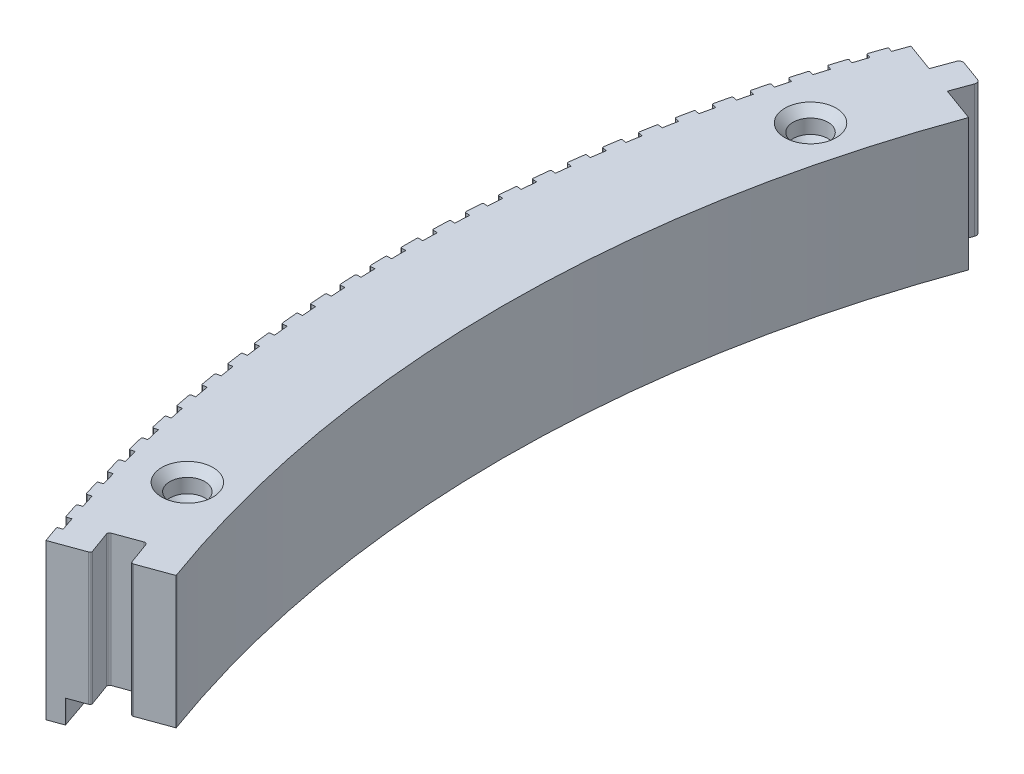
from build123d import *

# Parameters (mm, degrees)
CUT_EXTRUDE4_DEPTH                         = 448.112802595
TONGUE_DEPTH                               = 33.02
GROOVE_REACH                               = 337.991
NOTCH_DEPTH                                = 336.991121427
FILLET_NOTCH_R                             = 0.254
CIRPATTERN_NOTCHES_START                   = -38.862
CIRPATTERN_NOTCHES_DEPTH                   = 38.862
CUT_EXTRUDE7_DEPTH                         = 38.862
SKETCH4_R                                  = 2.1971
HOLES_MOUNTINGBOTTOM_DEPTH                 = 336.365614775
SKETCH11_R                                 = 4.3815
RELIEFHOLESFORSOCKETCAPSCREWS_DEPTH        = 7.62
CHAMFER_RELIEFHOLESFORSOCKETCAPSCREWS_SIZE = 2.032
SKETCH12_W                                 = 8.8519
SKETCH12_H                                 = 33.02
EXTENDLENGTH_DEPTH                         = 0.3048
FILLET_GROOVE_R                            = 0.508
RELIEF_VERSIONNUMBER_DEPTH                 = 0.6


# Read off the part's stored shape, not the designer's step: CirPattern-Notches
with BuildPart() as part:
    # Sketch1 → Revolve1 (revolve)
    with BuildSketch(Plane.XY, mode=Mode.PRIVATE) as revolve1_sk:
        Polygon((-289.56, 0), (-314.96, 0), (-314.96, -38.862), (-311.15, -38.862), (-311.15, -33.02), (-289.56, -33.02), align=None)
    revolve(revolve1_sk.sketch.rotate(Axis((0, 4.1402, 0), (0, -1, 0)), 270), axis=Axis((0, 4.1402, 0), (0, -1, 0)))

    # Sketch3 → Cut-Extrude4 (cut, through all)
    with BuildSketch(Plane(origin=(0, 0, 0), x_dir=(1, 0, 0), z_dir=(0, 1, 0))):
        with BuildLine():
            Line((-340.36, 123.880908935), (0, 0))
            Line((0, 0), (-170.18, -61.940454467))
            Line((-170.18, -61.940454467), (-170.180868731, -61.938067648))
            Line((-170.180868731, -61.938067648), (-340.36, -123.878205923))
            Line((-340.36, -123.878205923), (-340.36, -123.880908935))
            ThreePointArc((-340.36, -123.880908935), (362.20354664, 0), (-340.36, 123.880908935))
        make_face()
    extrude(amount=-CUT_EXTRUDE4_DEPTH, mode=Mode.SUBTRACT)

    # Sketch5 → Tongue (add)
    with BuildSketch(Plane(origin=(0, 0, 0), x_dir=(1, 0, 0), z_dir=(0, 1, 0))):
        with BuildLine():
            Line((-280.451262674, 102.075911776), (-278.626927229, 107.088232215))
            ThreePointArc((-278.626927229, 107.088232215), (-278.66084622, 107.865104834), (-279.234162466, 108.390452383))
            Line((-279.234162466, 108.390452383), (-284.485164831, 110.301660944))
            ThreePointArc((-284.485164831, 110.301660944), (-285.262037451, 110.267741953), (-285.787384999, 109.694425707))
            Line((-285.787384999, 109.694425707), (-287.611720444, 104.682105268))
            Line((-287.611720444, 104.682105268), (-280.451262674, 102.075911776))
        make_face()
    extrude(amount=-TONGUE_DEPTH)

    # Sketch6 → Groove (cut, up to next)
    with BuildSketch(Plane(origin=(0, 0, 0), x_dir=(1, 0, 0), z_dir=(0, 1, 0)), mode=Mode.PRIVATE) as groove_sk1:
        with BuildLine():
            Line((-128.707819823, -518.876197579), (-280.416329106, -102.060493985))
            Line((-280.416329106, -102.060493985), (-282.457847341, -96.451468732))
            ThreePointArc((-282.457847341, -96.451468732), (-282.786189559, -96.093146078), (-283.271734947, -96.071946709))
            Line((-283.271734947, -96.071946709), (-289.310387666, -98.269836554))
            ThreePointArc((-289.310387666, -98.269836554), (-289.66871032, -98.598178772), (-289.689909689, -99.083724159))
            Line((-289.689909689, -99.083724159), (-287.648391454, -104.692749412))
            Line((-287.648391454, -104.692749412), (-135.939882171, -521.508453006))
            Line((-135.939882171, -521.508453006), (167.477136395, -1355.139860195))
            Line((167.477136395, -1355.139860195), (174.709198743, -1352.507604768))
            Line((174.709198743, -1352.507604768), (-128.707819823, -518.876197579))
        make_face()
    groove_tool1 = extrude(groove_sk1.sketch, amount=-GROOVE_REACH, mode=Mode.PRIVATE) & part.part
    add(groove_tool1.solids().sort_by_distance((-57.595102, 0, 725.507875))[0], mode=Mode.SUBTRACT)

    # Sketch7 → Notch (cut, through all)
    with BuildSketch(Plane(origin=(0, 0, 0), x_dir=(1, 0, 0), z_dir=(0, 1, 0))):
        with BuildLine():
            Line((-296.152118835, -103.418270192), (-297.351115267, -103.836967642))
            ThreePointArc((-297.351115267, -103.836967642), (-297.935324969, -102.148635505), (-298.509948564, -100.457016721))
            Line((-298.509948564, -100.457016721), (-297.306279416, -100.051948106))
            ThreePointArc((-297.306279416, -100.051948106), (-296.733972852, -101.736745845), (-296.152118835, -103.418270192))
        make_face()
    extrude(amount=-NOTCH_DEPTH, mode=Mode.SUBTRACT)

    # Fillet-Notch
    fillet_notch_edges = [part.edges().sort_by_distance(p)[0] for p in [
        (-297.351115267, -19.431, 103.836967642),
        (-298.509948564, -19.431, 100.457016721),
    ]]
    fillet(fillet_notch_edges, radius=FILLET_NOTCH_R)

    # CirPattern-Notches outline → CirPattern-Notches (cut)
    with BuildSketch(Plane(origin=(0, 0, 0), x_dir=(1, 0, 0), z_dir=(0, 1, 0)).offset(CIRPATTERN_NOTCHES_START)):
        with BuildLine():
            ThreePointArc((-300.677925926, -92.91171498), (-300.871579672, -92.893613819), (-300.995653659, -92.743830406))
            ThreePointArc((-300.995653659, -92.743830406), (-300.388413072, -94.692147997), (-299.768561346, -96.636490149))
            ThreePointArc((-299.768561346, -96.636490149), (-299.752814694, -96.442630747), (-299.604550019, -96.316745835))
            Line((-299.604550019, -96.316745835), (-298.637400959, -96.005827158))
            ThreePointArc((-298.637400959, -96.005827158), (-299.177169471, -94.31032482), (-299.707311918, -92.611788034))
            Line((-299.707311918, -92.611788034), (-300.677925926, -92.91171498))
        make_face()
        with BuildLine():
            ThreePointArc((-302.899971537, -85.389748583), (-303.093114045, -85.366827052), (-303.213416788, -85.213998144))
            ThreePointArc((-303.213416788, -85.213998144), (-302.654918271, -87.176843521), (-302.083713462, -89.136028972))
            ThreePointArc((-302.083713462, -89.136028972), (-302.063140584, -88.942622194), (-301.911784812, -88.820471241))
            Line((-301.911784812, -88.820471241), (-300.937187802, -88.533751179))
            ThreePointArc((-300.937187802, -88.533751179), (-301.434535536, -86.82532399), (-301.922184575, -85.114103186))
            Line((-301.922184575, -85.114103186), (-302.899971537, -85.389748583))
        make_face()
        with BuildLine():
            ThreePointArc((-304.933874218, -77.814743298), (-305.126385521, -77.787015635), (-305.242842295, -77.631236161))
            ThreePointArc((-305.242842295, -77.631236161), (-304.733432753, -79.607390123), (-304.211229658, -81.580201947))
            ThreePointArc((-304.211229658, -81.580201947), (-304.185843333, -81.387367926), (-304.031490478, -81.269026805))
            Line((-304.031490478, -81.269026805), (-303.050050877, -81.00668345))
            ThreePointArc((-303.050050877, -81.00668345), (-303.504668912, -79.286392582), (-303.949521645, -77.563550665))
            Line((-303.949521645, -77.563550665), (-304.933874218, -77.814743298))
        make_face()
        with BuildLine():
            ThreePointArc((-306.778370634, -70.191404256), (-306.970131155, -70.158887684), (-307.082669624, -70.000254403))
            ThreePointArc((-307.082669624, -70.000254403), (-306.622665473, -71.988489486), (-306.149788452, -73.973702292))
            ThreePointArc((-306.149788452, -73.973702292), (-306.119604448, -73.781560806), (-305.962350384, -73.667103022))
            Line((-305.962350384, -73.667103022), (-304.974677802, -73.429299326))
            ThreePointArc((-304.974677802, -73.429299326), (-305.386283757, -71.698213319), (-305.788063869, -69.964820412))
            Line((-305.788063869, -69.964820412), (-306.778370634, -70.191404256))
        make_face()
        with BuildLine():
            ThreePointArc((-308.432315096, -62.524466608), (-308.623205726, -62.487181324), (-308.731755988, -62.32579277))
            ThreePointArc((-308.731755988, -62.32579277), (-308.321442953, -64.324874003), (-307.898185729, -66.3212547))
            ThreePointArc((-307.898185729, -66.3212547), (-307.863222795, -66.129925094), (-307.703165198, -66.019421742))
            Line((-307.703165198, -66.019421742), (-306.709873118, -65.806305413))
            ThreePointArc((-306.709873118, -65.806305413), (-307.078211328, -64.065499511), (-307.436669257, -62.322632293))
            Line((-307.436669257, -62.322632293), (-308.432315096, -62.524466608))
        make_face()
        with BuildLine():
            ThreePointArc((-309.894680275, -54.818692587), (-310.084582444, -54.776661751), (-310.189077075, -54.612618168))
            ThreePointArc((-310.189077075, -54.612618168), (-309.828710017, -56.621303845), (-309.455335491, -58.627612402))
            ThreePointArc((-309.455335491, -58.627612402), (-309.415615344, -58.437213518), (-309.252853633, -58.330733236))
            Line((-309.252853633, -58.330733236), (-308.254559026, -58.142436651))
            ThreePointArc((-308.254559026, -58.142436651), (-308.579400703, -56.392992136), (-308.894313797, -54.641733169))
            Line((-308.894313797, -54.641733169), (-309.894680275, -54.818692587))
        make_face()
        with BuildLine():
            ThreePointArc((-311.164557841, -47.078868548), (-311.353353594, -47.032118267), (-311.453727687, -46.865521549))
            ThreePointArc((-311.453727687, -46.865521549), (-311.143530444, -48.882563997), (-310.820270534, -50.897554219))
            ThreePointArc((-310.820270534, -50.897554219), (-310.775817844, -50.708204322), (-310.610453117, -50.605813248))
            Line((-310.610453117, -50.605813248), (-309.607776063, -50.442453364))
            ThreePointArc((-309.607776063, -50.442453364), (-309.888919434, -48.685456884), (-310.160092089, -46.926893943))
            Line((-310.160092089, -46.926893943), (-311.164557841, -47.078868548))
        make_face()
        with BuildLine():
            ThreePointArc((-312.241159021, -39.309801997), (-312.428731089, -39.258361308), (-312.524922299, -39.089314936))
            ThreePointArc((-312.524922299, -39.089314936), (-312.265087547, -41.113461291), (-311.992143042, -43.135881588))
            ThreePointArc((-311.992143042, -43.135881588), (-311.942985422, -42.947698291), (-311.775120392, -42.849460025))
            Line((-311.775120392, -42.849460025), (-310.768683693, -42.711138311))
            ThreePointArc((-310.768683693, -42.711138311), (-311.005954129, -40.947681204), (-311.233217909, -39.182906601))
            Line((-311.233217909, -39.182906601), (-312.241159021, -39.309801997))
        make_face()
        with BuildLine():
            ThreePointArc((-313.123815098, -31.516318602), (-313.310046973, -31.460219458), (-313.401995551, -31.288828431))
            ThreePointArc((-313.401995551, -31.288828431), (-313.192684684, -33.318821418), (-312.970225119, -35.347415588))
            ThreePointArc((-312.970225119, -35.347415588), (-312.916393103, -35.160515778), (-312.746132039, -35.06649134))
            Line((-312.746132039, -35.06649134), (-311.736560831, -34.953293713))
            ThreePointArc((-311.736560831, -34.953293713), (-311.929810955, -33.184471332), (-312.113024697, -31.414581236))
            Line((-312.113024697, -31.414581236), (-313.123815098, -31.516318602))
        make_face()
        with BuildLine():
            ThreePointArc((-313.81197782, -23.703259198), (-313.996753825, -23.642536444), (-314.084402659, -23.468907221))
            ThreePointArc((-314.084402659, -23.468907221), (-313.925745687, -25.503485932), (-313.753909243, -27.536993936))
            ThreePointArc((-313.753909243, -27.536993936), (-313.695436267, -27.351493704), (-313.522884923, -27.261741495))
            Line((-313.522884923, -27.261741495), (-312.510806291, -27.173738267))
            ThreePointArc((-312.510806291, -27.173738267), (-312.659916068, -25.400649296), (-312.798965971, -23.626743055))
            Line((-312.798965971, -23.626743055), (-313.81197782, -23.703259198))
        make_face()
        with BuildLine():
            ThreePointArc((-314.305219742, -15.87547678), (-314.488425107, -15.810168133), (-314.571719754, -15.634408562))
            ThreePointArc((-314.571719754, -15.634408562), (-314.463815225, -17.672309241), (-314.342708635, -19.709467988))
            ThreePointArc((-314.342708635, -19.709467988), (-314.279631019, -19.525482555), (-314.104896575, -19.440058325))
            Line((-314.104896575, -19.440058325), (-313.090939159, -19.377304157))
            ThreePointArc((-313.090939159, -19.377304157), (-313.19581597, -17.60104993), (-313.290615666, -15.824229386))
            Line((-313.290615666, -15.824229386), (-314.305219742, -15.87547678))
        make_face()
        with BuildLine():
            ThreePointArc((-314.603234492, -8.037833487), (-314.78475542, -7.967979513), (-314.863644143, -7.790198765))
            ThreePointArc((-314.863644143, -7.790198765), (-314.806559082, -9.830155593), (-314.736257569, -11.869699724))
            ThreePointArc((-314.736257569, -11.869699724), (-314.668614494, -11.687343371), (-314.491805483, -11.60630018))
            Line((-314.491805483, -11.60630018), (-313.476599093, -11.568834052))
            ThreePointArc((-313.476599093, -11.568834052), (-313.537177795, -9.790517869), (-313.587668399, -8.011886675))
            Line((-313.587668399, -8.011886675), (-314.603234492, -8.037833487))
        make_face()
        with BuildLine():
            ThreePointArc((-314.705836962, -0.195197584), (-314.885560704, -0.120841672), (-314.959994502, 0.058849827))
            ThreePointArc((-314.959994502, 0.058849827), (-314.953764366, -1.981896054), (-314.934311597, -4.022558729))
            ThreePointArc((-314.934311597, -4.022558729), (-314.862145078, -3.841944725), (-314.683371324, -3.765332911))
            Line((-314.683371324, -3.765332911), (-313.667546543, -3.753178095))
            ThreePointArc((-313.667546543, -3.753178095), (-313.683789509, -1.973904537), (-313.689939659, -0.194567469))
            Line((-313.689939659, -0.194567469), (-314.705836962, -0.195197584))
        make_face()
        with BuildLine():
            ThreePointArc((-314.612963421, 7.647559564), (-314.790778343, 7.726371229), (-314.860710983, 7.907861865))
            ThreePointArc((-314.860710983, 7.907861865), (-314.905339641, 5.867594518), (-314.936747701, 3.827080833))
            ThreePointArc((-314.936747701, 3.827080833), (-314.860102563, 4.005840302), (-314.679475109, 4.077973152))
            Line((-314.679475109, 4.077973152), (-313.663662905, 4.064809106))
            ThreePointArc((-313.663662905, 4.064809106), (-313.635560046, 5.843934862), (-313.597365922, 7.622872589))
            Line((-313.597365922, 7.622872589), (-314.612963421, 7.647559564))
        make_face()
        with BuildLine():
            ThreePointArc((-314.324671557, 15.485566516), (-314.500467212, 15.568784981), (-314.565855255, 15.751962023))
            ThreePointArc((-314.565855255, 15.751962023), (-314.661314988, 13.713440499), (-314.743564366, 11.674343247))
            ThreePointArc((-314.743564366, 11.674343247), (-314.662488217, 11.851137147), (-314.480119258, 11.918746228))
            Line((-314.480119258, 11.918746228), (-313.464950591, 11.880271497))
            ThreePointArc((-313.464950591, 11.880271497), (-313.392519363, 13.658144368), (-313.310004689, 15.435577786))
            Line((-313.310004689, 15.435577786), (-314.324671557, 15.485566516))
        make_face()
        with BuildLine():
            ThreePointArc((-313.84114044, 23.313954782), (-314.014807633, 23.401528356), (-314.075610465, 23.586278026))
            ThreePointArc((-314.075610465, 23.586278026), (-314.221841978, 21.55076853), (-314.354881587, 19.514354273))
            ThreePointArc((-314.354881587, 19.514354273), (-314.269424786, 19.68907279), (-314.085427598, 19.752116107))
            Line((-314.085427598, 19.752116107), (-313.07153303, 19.688354591))
            ThreePointArc((-313.07153303, 19.688354591), (-312.954818421, 21.46387027), (-312.828034451, 23.238695346))
            Line((-312.828034451, 23.238695346), (-313.84114044, 23.313954782))
        make_face()
        with BuildLine():
            ThreePointArc((-313.162670408, 31.127861845), (-313.334101269, 31.219736133), (-313.390281122, 31.405943677))
            ThreePointArc((-313.390281122, 31.405943677), (-313.587193585, 29.374710542), (-313.770940789, 27.342244176))
            ThreePointArc((-313.770940789, 27.342244176), (-313.681156416, 27.514778785), (-313.495645288, 27.573217181))
            Line((-313.495645288, 27.573217181), (-312.483654587, 27.484208483))
            ThreePointArc((-312.483654587, 27.484208483), (-312.322729095, 29.256264129), (-312.151754579, 31.027378451))
            Line((-312.151754579, 31.027378451), (-313.162670408, 31.127861845))
        make_face()
        with BuildLine():
            ThreePointArc((-312.289682886, 38.922434186), (-312.458770933, 39.018552121), (-312.510292912, 39.206101876))
            ThreePointArc((-312.510292912, 39.206101876), (-312.757764015, 37.180406781), (-312.992104681, 35.15315075))
            ThreePointArc((-312.992104681, 35.15315075), (-312.898048506, 35.323394284), (-312.711138664, 35.377191459))
            Line((-312.711138664, 35.377191459), (-311.701680418, 35.262990866))
            ThreePointArc((-311.701680418, 35.262990866), (-311.496643999, 37.030485786), (-311.281585135, 38.796789246))
            Line((-311.281585135, 38.796789246), (-312.289682886, 38.922434186))
        make_face()
        with BuildLine():
            ThreePointArc((-311.222720121, 46.692830291), (-311.389360326, 46.793132171), (-311.436192428, 46.981907644))
            ThreePointArc((-311.436192428, 46.981907644), (-311.734068458, 44.963008826), (-312.018857028, 42.942222337))
            ThreePointArc((-312.018857028, 42.942222337), (-311.920587472, 43.110069052), (-311.732395014, 43.159191591))
            Line((-311.732395014, 43.159191591), (-310.726096236, 43.019870037))
            ThreePointArc((-310.726096236, 43.019870037), (-310.477076246, 44.781706372), (-310.218066617, 46.54210185))
            Line((-310.218066617, 46.54210185), (-311.222720121, 46.692830291))
        make_face()
        with BuildLine():
            ThreePointArc((-309.962444844, 54.434223667), (-310.1265337, 54.538647191), (-310.168646837, 54.728531126))
            ThreePointArc((-310.168646837, 54.728531126), (-310.516742771, 52.717682602), (-310.851802352, 50.704620844))
            ThreePointArc((-310.851802352, 50.704620844), (-310.749380454, 50.869966482), (-310.560022274, 50.914383873))
            Line((-310.560022274, 50.914383873), (-309.557508015, 50.750027897))
            ThreePointArc((-309.557508015, 50.750027897), (-309.264659131, 52.505111301), (-308.961859616, 54.258505347))
            Line((-308.961859616, 54.258505347), (-309.962444844, 54.434223667))
        make_face()
        with BuildLine():
            ThreePointArc((-308.509639862, 62.141805835), (-308.671075447, 62.250286141), (-308.708443461, 62.441160593))
            ThreePointArc((-308.708443461, 62.441160593), (-309.106543083, 60.439611379), (-309.491665555, 58.435524742))
            ThreePointArc((-309.491665555, 58.435524742), (-309.385154934, 58.598266601), (-309.19474865, 58.637951256))
            Line((-309.19474865, 58.637951256), (-308.196641611, 58.448662944))
            ThreePointArc((-308.196641611, 58.448662944), (-307.860145731, 60.195903268), (-307.513744412, 61.941206781))
            Line((-307.513744412, 61.941206781), (-308.509639862, 62.141805835))
        make_face()
        with BuildLine():
            ThreePointArc((-306.865207567, 69.810789314), (-307.023889609, 69.92325902), (-307.056489287, 70.115005431))
            ThreePointArc((-307.056489287, 70.115005431), (-307.504345322, 68.123998767), (-307.939291473, 66.130132068))
            ThreePointArc((-307.939291473, 66.130132068), (-307.828758286, 66.290169063), (-307.637422166, 66.325096331))
            Line((-307.637422166, 66.325096331), (-306.644342309, 66.110993259))
            ThreePointArc((-306.644342309, 66.110993259), (-306.264408446, 67.849305224), (-305.874620486, 69.585434128))
            Line((-305.874620486, 69.585434128), (-306.865207567, 69.810789314))
        make_face()
        with BuildLine():
            ThreePointArc((-305.030169382, 77.436410603), (-305.185999315, 77.55279985), (-305.21381041, 77.745299118))
            ThreePointArc((-305.21381041, 77.745299118), (-305.711144678, 75.766071695), (-306.195644344, 73.783663402))
            ThreePointArc((-306.195644344, 73.783663402), (-306.081157248, 73.940896128), (-305.889010138, 73.971044314))
            Line((-305.889010138, 73.971044314), (-304.901574305, 73.732259469))
            ThreePointArc((-304.901574305, 73.732259469), (-304.478438449, 75.460563341), (-304.04550596, 77.18643926))
            Line((-304.04550596, 77.18643926), (-305.030169382, 77.436410603))
        make_face()
        with BuildLine():
            ThreePointArc((-303.005665118, 85.013933131), (-303.158546151, 85.134169626), (-303.181551389, 85.327302181))
            ThreePointArc((-303.181551389, 85.327302181), (-303.728054975, 83.361083375), (-304.261807215, 81.391364839))
            ThreePointArc((-304.261807215, 81.391364839), (-304.143437323, 81.545695632), (-303.950598573, 81.57104601))
            Line((-303.950598573, 81.57104601), (-302.969420098, 81.307727711))
            ThreePointArc((-302.969420098, 81.307727711), (-302.503345075, 83.024949974), (-302.027536969, 84.739500899))
            Line((-302.027536969, 84.739500899), (-303.005665118, 85.013933131))
        make_face()
        with BuildLine():
            ThreePointArc((-300.792952275, 92.538650205), (-300.942789448, 92.662659264), (-300.960974538, 92.856305146))
            ThreePointArc((-300.960974538, 92.856305146), (-301.556307988, 90.904316251), (-302.138981268, 88.94851094))
            ThreePointArc((-302.138981268, 88.94851094), (-302.016802103, 89.099843939), (-301.823391493, 89.120380764))
            Line((-301.823391493, 89.120380764), (-300.849079824, 88.832692568))
            ThreePointArc((-300.849079824, 88.832692568), (-300.340355133, 90.537766588), (-299.821966951, 92.239927544))
            Line((-299.821966951, 92.239927544), (-300.792952275, 92.538650205))
        make_face()
        with BuildLine():
            ThreePointArc((-298.393405254, 100.005887933), (-298.540105496, 100.133592529), (-298.553459144, 100.327631455))
            ThreePointArc((-298.553459144, 100.327631455), (-299.197252673, 98.391084927), (-299.828485072, 96.450407668))
            ThreePointArc((-299.828485072, 96.450407668), (-299.702572525, 96.598648875), (-299.50871019, 96.614359389))
            Line((-299.50871019, 96.614359389), (-298.54187051, 96.302479991))
            ThreePointArc((-298.54187051, 96.302479991), (-297.990812138, 97.994346681), (-297.430165873, 99.683060391))
            Line((-297.430165873, 99.683060391), (-298.393405254, 100.005887933))
        make_face()
        with BuildLine():
            ThreePointArc((-296.049225252, 103.712450206), (-295.456175483, 105.390058682), (-294.853619374, 107.064276219))
            Line((-294.853619374, 107.064276219), (-295.808923812, 107.411156744))
            ThreePointArc((-295.808923812, 107.411156744), (-295.949150754, 107.535782222), (-295.965587843, 107.722664342))
            ThreePointArc((-295.965587843, 107.722664342), (-296.6548527, 105.809734758), (-297.331753767, 103.892395304))
            ThreePointArc((-297.331753767, 103.892395304), (-297.202186047, 104.037452641), (-297.007992402, 104.048327086))
            Line((-297.007992402, 104.048327086), (-296.049225252, 103.712450206))
        make_face()
    extrude(amount=CIRPATTERN_NOTCHES_DEPTH, mode=Mode.SUBTRACT)

    # Sketch15 → Cut-Extrude7 (cut)
    with BuildSketch(Plane(origin=(0, 0, 0), x_dir=(1, 0, 0), z_dir=(0, 1, 0))):
        Polygon((-294.853619374, 107.064276219), (-294.772093111, 107.288267785), (-295.965587843, 107.722664342), (-296.129135555, 107.273320694), (-294.934890273, 106.840191873), align=None)
    extrude(amount=-CUT_EXTRUDE7_DEPTH, mode=Mode.SUBTRACT)

    # Sketch4 → Holes_MountingBottom (cut, through all)
    with BuildSketch(Plane(origin=(0, -33.02, 0), x_dir=(1, 0, 0), z_dir=(0, 1, 0))):
        with Locations(Location((-290.781777788, -77.723470113, 0), (0, 0, 270))):
            Circle(SKETCH4_R)
        with Locations(Location((-290.686141578, 78.080389306, 0), (0, 0, 270))):
            Circle(SKETCH4_R)
    extrude(amount=HOLES_MOUNTINGBOTTOM_DEPTH, mode=Mode.SUBTRACT)

    # Sketch11 → ReliefHolesForSocketCapScrews (cut)
    with BuildSketch(Plane(origin=(0, 0, 0), x_dir=(1, 0, 0), z_dir=(0, 1, 0))):
        with Locations(Location((-290.781777788, -77.723470113, 0), (0, 0, 270))):
            Circle(SKETCH11_R)
        with Locations(Location((-290.686141578, 78.080389306, 0), (0, 0, 270))):
            Circle(SKETCH11_R)
    extrude(amount=-RELIEFHOLESFORSOCKETCAPSCREWS_DEPTH, mode=Mode.SUBTRACT)

    # Chamfer-ReliefHolesForSocketCapScrews
    chamfer_reliefholesforsocketcapscrews_edges = [part.edges().sort_by_distance(p)[0] for p in [
        (-290.781777788, -7.62, 73.341970113),
        (-290.781777788, 0, 73.341970113),
        (-290.686141578, -7.62, -82.461889306),
        (-290.686141578, 0, -82.461889306),
    ]]
    chamfer(chamfer_reliefholesforsocketcapscrews_edges, length=CHAMFER_RELIEFHOLESFORSOCKETCAPSCREWS_SIZE)

    # Sketch12 → ExtendLength (add)
    with BuildSketch(Plane(origin=(-0.000868731, 0, -0.002386819), x_dir=(0.9396926207859094, 0, -0.3420201433256661), z_dir=(0.3420201433256661, 0, 0.9396926207859094))):
        Polygon((-306.108099989, -33.02), (-306.108099989, 0), (-314.95999999, 0), (-314.95999999, -38.862), (-311.14999999, -38.862), (-311.14999999, -33.02), align=None)
        with Locations((-293.985949989, -16.51)):
            Rectangle(SKETCH12_W, SKETCH12_H)
    extrude(amount=EXTENDLENGTH_DEPTH)

    # Fillet-Groove
    fillet_groove_edges = [part.edges().sort_by_distance(p)[0] for p in [
        (-287.544143714, -16.51, 104.979167723),
        (-280.312081366, -16.51, 102.346912296),
    ]]
    fillet(fillet_groove_edges, radius=FILLET_GROOVE_R)

    # Sketch13 → Relief_VersionNumber (cut)
    with BuildSketch(Plane.XZ.offset(33.02)):
        with BuildLine():
            Line((-300.164523786, 1.710258352), (-300.164523786, 0.79846348))
            add(Edge.make_bspline(
                [(-300.164523786, 0.79846348), (-300.210111133, 0.804860939), (-300.299154503, 0.81735676), (-300.428375502, 0.848074923), (-300.551255139, 0.883598616), (-300.667133959, 0.929028395), (-300.775887041, 0.98146888), (-300.877611707, 1.042621602), (-300.97376779, 1.109649036), (-301.031391155, 1.162127326), (-301.060036606, 1.188215083)],
                knots=[0, 0, 0, 0, 1.1115466, 2.171125598, 3.205689823, 4.19946166, 5.17440286, 6.118867946, 7.064860634, 8, 8, 8, 8], degree=3))
            add(Edge.make_bspline(
                [(-301.060036606, 1.188215083), (-301.097890636, 1.225750414), (-301.172496949, 1.299728608), (-301.268059396, 1.423354847), (-301.350762195, 1.552937976), (-301.416329572, 1.691076842), (-301.469398767, 1.835621899), (-301.505045466, 1.987722622), (-301.528697366, 2.14675747), (-301.53102716, 2.255278746), (-301.532216094, 2.310658993)],
                knots=[0, 0, 0, 0, 1.01925491, 2.00884431, 2.983262333, 3.955970413, 4.92937149, 5.924503185, 6.940838805, 8, 8, 8, 8], degree=3))
            add(Edge.make_bspline(
                [(-301.532216094, 2.310658993), (-301.531053731, 2.359894881), (-301.52876876, 2.456682717), (-301.510426251, 2.598936482), (-301.478255534, 2.734563542), (-301.436193043, 2.864997515), (-301.378959995, 2.988320142), (-301.312524607, 3.107253273), (-301.231038844, 3.218473912), (-301.138968131, 3.322242295), (-301.039384643, 3.417573345), (-300.932938083, 3.500130452), (-300.822471885, 3.571106279), (-300.707068284, 3.629580972), (-300.586532003, 3.674540065), (-300.461559363, 3.705743009), (-300.332426127, 3.726166093), (-300.244656006, 3.728200766), (-300.200140773, 3.729232711)],
                knots=[0, 0, 0, 0, 1.091422571, 2.145516843, 3.172569842, 4.178562979, 5.178154469, 6.181868002, 7.194278174, 8.227918432, 9.254613415, 10.245994977, 11.209837596, 12.161663635, 13.10878368, 14.055455738, 15.013766427, 16, 16, 16, 16], degree=3))
            add(Edge.make_bspline(
                [(-300.200140773, 3.729232711), (-300.145022151, 3.727074325), (-300.036178128, 3.72281211), (-299.877190244, 3.689104243), (-299.725514724, 3.634916925), (-299.582948706, 3.557870588), (-299.449640703, 3.461117223), (-299.330246564, 3.342467555), (-299.222917261, 3.205232627), (-299.165237756, 3.102211402), (-299.135701671, 3.04945707)],
                knots=[0, 0, 0, 0, 0.992776698, 1.96045919, 2.915875678, 3.886951799, 4.871409521, 5.874469288, 6.911574252, 8, 8, 8, 8], degree=3))
            add(Edge.make_bspline(
                [(-299.135701671, 3.04945707), (-299.123814758, 3.085668188), (-299.100457507, 3.156821411), (-299.054427253, 3.25793677), (-299.004230705, 3.354165062), (-298.945631602, 3.443305581), (-298.882691593, 3.527802793), (-298.812026579, 3.60498332), (-298.735450418, 3.676845727), (-298.652148485, 3.741612227), (-298.56350579, 3.799516481), (-298.471115554, 3.850546934), (-298.374640105, 3.893371075), (-298.274788406, 3.929313163), (-298.170577752, 3.95673598), (-298.062361298, 3.976028926), (-297.95039979, 3.987184354), (-297.874545412, 3.98888541), (-297.836190453, 3.989745531)],
                knots=[0, 0, 0, 0, 1.059375415, 2.081625174, 3.086260357, 4.075579879, 5.045586876, 6.014170127, 6.982201689, 7.963705737, 8.945119069, 9.924852636, 10.896327119, 11.878239286, 12.873838556, 13.889973282, 14.933087432, 16, 16, 16, 16], degree=3))
            add(Edge.make_bspline(
                [(-297.836190453, 3.989745531), (-297.779824283, 3.988001807), (-297.668681675, 3.984563539), (-297.504980294, 3.9627041), (-297.348904392, 3.922007348), (-297.198663652, 3.868463277), (-297.056176994, 3.797060906), (-296.918253003, 3.712960267), (-296.789569038, 3.610018471), (-296.667655538, 3.494578902), (-296.55627655, 3.36704587), (-296.457871979, 3.229812054), (-296.376753017, 3.082611569), (-296.307417588, 2.92900316), (-296.255959795, 2.765526361), (-296.218276555, 2.594295866), (-296.195348926, 2.414061286), (-296.192935716, 2.291052548), (-296.191703273, 2.228231108)],
                knots=[0, 0, 0, 0, 1.005228408, 1.982105694, 2.937129188, 3.876607107, 4.82066901, 5.774063015, 6.75178259, 7.752926466, 8.764612432, 9.766578198, 10.757677051, 11.756882247, 12.76686714, 13.807379907, 14.880213281, 16, 16, 16, 16], degree=3))
            add(Edge.make_bspline(
                [(-296.191703273, 2.228231108), (-296.192999703, 2.168801774), (-296.1955347, 2.052595576), (-296.217476383, 1.882619691), (-296.252870098, 1.721073701), (-296.302760474, 1.567545339), (-296.367459766, 1.422628593), (-296.444502106, 1.285009303), (-296.538331117, 1.157433631), (-296.644711179, 1.038480131), (-296.764063569, 0.930787554), (-296.893623548, 0.83453575), (-297.033883778, 0.75184709), (-297.184245011, 0.682382466), (-297.344971024, 0.626684934), (-297.515734974, 0.582750884), (-297.696870479, 0.552062232), (-297.821495561, 0.542715938), (-297.885036606, 0.537950659)],
                knots=[0, 0, 0, 0, 1.066544725, 2.085487077, 3.070979577, 4.031932826, 4.977951092, 5.916076795, 6.857635327, 7.814973522, 8.776389752, 9.738577119, 10.707772778, 11.69409279, 12.707140348, 13.757286496, 14.856535458, 16, 16, 16, 16], degree=3))
            Line((-297.885036606, 0.537950659), (-297.885036606, 1.449745531))
            add(Edge.make_bspline(
                [(-297.885036606, 1.449745531), (-297.853087867, 1.455524607), (-297.790859318, 1.466780873), (-297.700757354, 1.488715677), (-297.617620405, 1.517374965), (-297.540837683, 1.550141035), (-297.469621192, 1.586367771), (-297.405875388, 1.629652441), (-297.347095056, 1.67606321), (-297.279531025, 1.745829171), (-297.20867585, 1.84316867), (-297.145923263, 1.974960628), (-297.110233504, 2.122235496), (-297.105793192, 2.224986423), (-297.103498145, 2.27809489)],
                knots=[0, 0, 0, 0, 0.928450228, 1.808400301, 2.64896863, 3.43999153, 4.194978884, 4.9294959, 5.640047715, 6.332896648, 7.70085756, 9.063442004, 10.482192841, 12, 12, 12, 12], degree=3))
            add(Edge.make_bspline(
                [(-297.103498145, 2.27809489), (-297.103984167, 2.30628002), (-297.104936176, 2.361488385), (-297.115392127, 2.442601952), (-297.13281309, 2.519794888), (-297.155845895, 2.59370825), (-297.187101283, 2.663180469), (-297.223373058, 2.729784516), (-297.267775203, 2.792302346), (-297.318367233, 2.850369767), (-297.372390205, 2.904411156), (-297.431505498, 2.950556244), (-297.492874597, 2.990395604), (-297.558120735, 3.021831538), (-297.625184204, 3.048141471), (-297.696196573, 3.064550568), (-297.769616415, 3.076865867), (-297.819853001, 3.077585454), (-297.845349106, 3.077950659)],
                knots=[0, 0, 0, 0, 1.110702965, 2.175618623, 3.217100552, 4.227908035, 5.221854906, 6.215531843, 7.213608581, 8.237687243, 9.249555755, 10.220750668, 11.188994735, 12.127982202, 13.071814005, 14.022160605, 14.996205625, 16, 16, 16, 16], degree=3))
            add(Edge.make_bspline(
                [(-297.845349106, 3.077950659), (-297.873242513, 3.077021953), (-297.928438248, 3.07518422), (-298.009324954, 3.059012259), (-298.087432749, 3.03480522), (-298.162117182, 2.999991003), (-298.232939028, 2.954435051), (-298.300484835, 2.899043686), (-298.364216827, 2.833315822), (-298.425991138, 2.759452509), (-298.480068078, 2.674473493), (-298.529864853, 2.581810359), (-298.569515359, 2.479180274), (-298.604921955, 2.369045349), (-298.630784542, 2.249334786), (-298.649562674, 2.120788334), (-298.663540269, 1.983614412), (-298.66554557, 1.889058601), (-298.666575068, 1.840514762)],
                knots=[0, 0, 0, 0, 0.809868251, 1.602574917, 2.388262527, 3.182133002, 3.988875265, 4.829537611, 5.714850619, 6.646378958, 7.622533229, 8.636771727, 9.698525113, 10.814716514, 11.996253919, 13.252421425, 14.589425562, 16, 16, 16, 16], degree=3))
            Line((-298.666575068, 1.840514762), (-299.513241735, 1.840514762))
            add(Edge.make_bspline(
                [(-299.513241735, 1.840514762), (-299.518369763, 1.900962096), (-299.527963288, 2.014047087), (-299.55071388, 2.170907167), (-299.58014455, 2.303412766), (-299.61850069, 2.413078457), (-299.663303423, 2.505645686), (-299.715214908, 2.585376539), (-299.774825532, 2.654939319), (-299.842048439, 2.712157608), (-299.912511753, 2.759840631), (-299.987453165, 2.792482177), (-300.063890972, 2.814360854), (-300.116211226, 2.816418348), (-300.142135965, 2.817437839)],
                knots=[0, 0, 0, 0, 1.700711886, 3.181695139, 4.441392523, 5.500267777, 6.431839453, 7.31822765, 8.161090383, 8.990537424, 9.787217293, 10.536619396, 11.274893404, 12, 12, 12, 12], degree=3))
            add(Edge.make_bspline(
                [(-300.142135965, 2.817437839), (-300.17521648, 2.815686218), (-300.239782641, 2.812267424), (-300.332355218, 2.785194462), (-300.415313278, 2.739250524), (-300.487728902, 2.676911925), (-300.546799275, 2.600328277), (-300.590732427, 2.511696653), (-300.61636141, 2.411466163), (-300.619037302, 2.340997986), (-300.620421222, 2.304553224)],
                knots=[0, 0, 0, 0, 1.009324788, 1.969988301, 2.915956825, 3.885795408, 4.868116622, 5.850437836, 6.888288533, 8, 8, 8, 8], degree=3))
            add(Edge.make_bspline(
                [(-300.620421222, 2.304553224), (-300.618795074, 2.271516236), (-300.615568299, 2.205960733), (-300.591484507, 2.110098967), (-300.55094244, 2.019062226), (-300.495037319, 1.934735626), (-300.427897638, 1.858336437), (-300.348384622, 1.795634746), (-300.261262034, 1.743482452), (-300.196896282, 1.721376468), (-300.164523786, 1.710258352)],
                knots=[0, 0, 0, 0, 0.98818071, 1.960853194, 2.938124878, 3.957524365, 4.978590984, 5.968022688, 6.978025184, 8, 8, 8, 8], degree=3))
        make_face()
        Polygon((-301.401959683, -4.444357033), (-301.401959683, -3.470486841), (-297.793450068, -2.164869853), (-301.401959683, -0.856199982), (-301.401959683, 0.114617326), (-296.321959683, -1.727289725), (-296.321959683, -2.605502866), align=None)
    extrude(amount=-RELIEF_VERSIONNUMBER_DEPTH, mode=Mode.SUBTRACT)


solid = part.part
